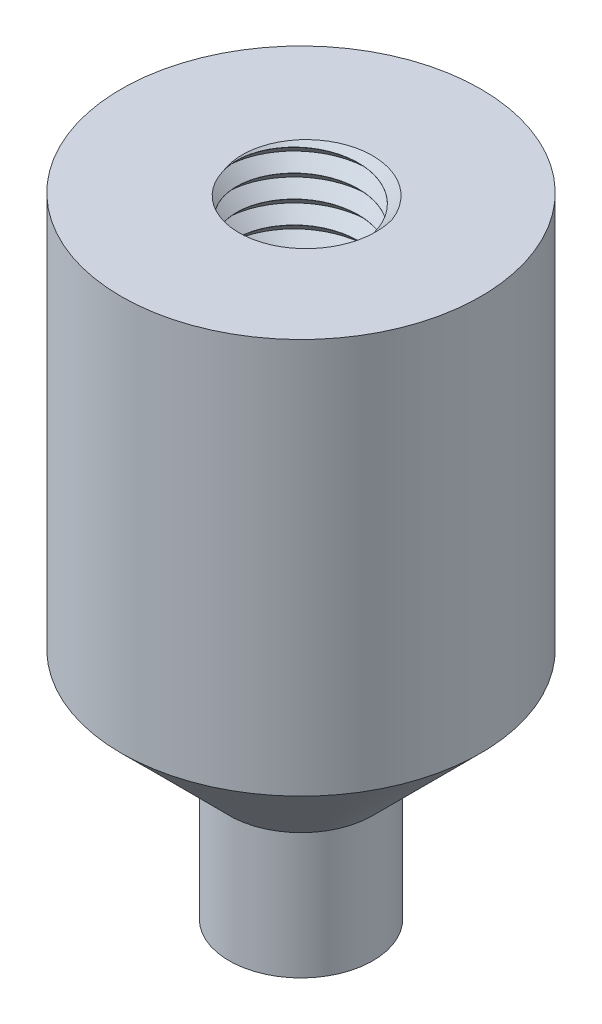
from build123d import *
from build123d.topology import SkipClean

# Parameters (mm, degrees)
SKETCH_1_W          = 6.6
SKETCH_1_H          = 11
SWEEP_1_PITCH       = 1.25
BOSS_EXTRUDE2_START = 0.82
SKETCH9_R           = 10
BOSS_EXTRUDE2_DEPTH = 0.82


with BuildPart() as part:
    # 草图1 → 旋转1 (revolve)
    with BuildSketch(Plane.XY, mode=Mode.PRIVATE) as revolve_1_sk:
        with Locations((6.7, -5.5)):
            Rectangle(SKETCH_1_W, SKETCH_1_H)
    revolve(revolve_1_sk.sketch.rotate(Axis((0, 16.878026906, 0), (0, -1, 0)), 90), axis=Axis((0, 16.878026906, 0), (0, -1, 0)))

    # 切除-扫描1: arcs per turn and ends read off the stored shape
    # 切除-扫描1: the profile of 草图3 profile screwed along a right-hand helix through 11.25 turns, 8 arcs to a turn; built about Z, then put on its axis
    sweep_1_z = Axis((0, 0, 0), (0, 0, 1))
    sweep_1_corners = [(3.3997, 0, -1.8702976), (3.3997, 0, -0.6297024), (4.025, 0, -1.25)]
    with BuildLine(mode=Mode.PRIVATE) as sweep_1_profile:
        Line(sweep_1_corners[0], sweep_1_corners[1])
        Line(sweep_1_corners[1], sweep_1_corners[2])
        Line(sweep_1_corners[2], sweep_1_corners[0])
    sweep_1_cap = Face(sweep_1_profile.wire())
    sweep_1_turn_angles = [0, 22.5, 45, 67.5, 90, 112.5, 135, 157.5, 180, 202.5, 225, 247.5, 270, 292.5, 315, 337.5, 360]
    sweep_1_turn_weights = [1, 0.9238795325112867, 1, 0.9238795325112867, 1, 0.9238795325112867, 1, 0.9238795325112867, 1, 0.9238795325112867, 1, 0.9238795325112867, 1, 0.9238795325112867, 1, 0.9238795325112867, 1]
    sweep_1_turn_rails = [Edge.make_bspline([Vector(p[0], p[1], 0).rotate(sweep_1_z, sweep_1_turn_angles[k]) / sweep_1_turn_weights[k] + Vector(0, 0, p[2] + SWEEP_1_PITCH * sweep_1_turn_angles[k] / 360) for k in range(17)], [0, 0, 0, 1, 1, 2, 2, 3, 3, 4, 4, 5, 5, 6, 6, 7, 7, 8, 8, 8], 2, sweep_1_turn_weights) for p in sweep_1_corners]
    sweep_1_turn_sides = [Face.make_surface_from_curves(sweep_1_turn_rails[p[0]], sweep_1_turn_rails[p[1]]) for p in [(0, 1), (1, 2), (2, 0)]]
    sweep_1_last_angles = [3960, 3982.5, 4005, 4027.5, 4050]
    sweep_1_last_weights = [1, 0.9238795325112867, 1, 0.9238795325112867, 1]
    sweep_1_last_rails = [Edge.make_bspline([Vector(p[0], p[1], 0).rotate(sweep_1_z, sweep_1_last_angles[k]) / sweep_1_last_weights[k] + Vector(0, 0, p[2] + SWEEP_1_PITCH * sweep_1_last_angles[k] / 360) for k in range(5)], [0, 0, 0, 1, 1, 2, 2, 2], 2, sweep_1_last_weights) for p in sweep_1_corners]
    sweep_1_last_sides = [Face.make_surface_from_curves(sweep_1_last_rails[p[0]], sweep_1_last_rails[p[1]]) for p in [(0, 1), (1, 2), (2, 0)]]
    sweep_1 = Plane(origin=(0, -11, 0), x_dir=(0, 0, -1), z_dir=(0, 1, 0)) * Solid(Shell([*[p.moved(Location((0, 0, SWEEP_1_PITCH * i))) for i in range(11) for p in sweep_1_turn_sides], *sweep_1_last_sides, sweep_1_cap, sweep_1_cap.rotate(sweep_1_z, 4050).moved(Location((0, 0, SWEEP_1_PITCH * 4050 / 360)))]))
    add(sweep_1, mode=Mode.SUBTRACT)

    # 草图4 → 旋转2 (revolve)
    with BuildSketch(Plane.XY, mode=Mode.PRIVATE) as revolve_2_sk:
        Polygon((0, -13.323834833), (4.025, -11), (10, -11), (10, -14.182082338), (0, -14.182082338), align=None)
    revolve(revolve_2_sk.sketch.rotate(Axis((0, 0, 0), (0, -1, 0)), 90), axis=Axis((0, 0, 0), (0, -1, 0)))

    # Sketch9 → Boss-Extrude2 (add)
    with BuildSketch(Plane.XZ.offset(14.182082338).offset(BOSS_EXTRUDE2_START)):
        with Locations(Location((0, 0, 0), (0, 0, 90))):
            Circle(SKETCH9_R)
    extrude(amount=-BOSS_EXTRUDE2_DEPTH)

    # Sketch10 → Revolve1 (revolve)
    with SkipClean():  # the faces are left unmerged after this step: merging them gives an invalid solid
        with BuildSketch(Plane(origin=(0, 0, 0), x_dir=(0, 0, -1), z_dir=(1, 0, 0)), mode=Mode.PRIVATE) as revolve1_sk:
            Polygon((-10, -15.002082338), (-10, -22.002082338), (-4, -28.002082338), (-4, -35.002082338), (0, -35.002082338), (0, -15.002082338), align=None)
        revolve(revolve1_sk.sketch.rotate(Axis((0, -35.002082338, 0), (0, 1, 0)), 270), axis=Axis((0, -35.002082338, 0), (0, 1, 0)))


solid = part.part
